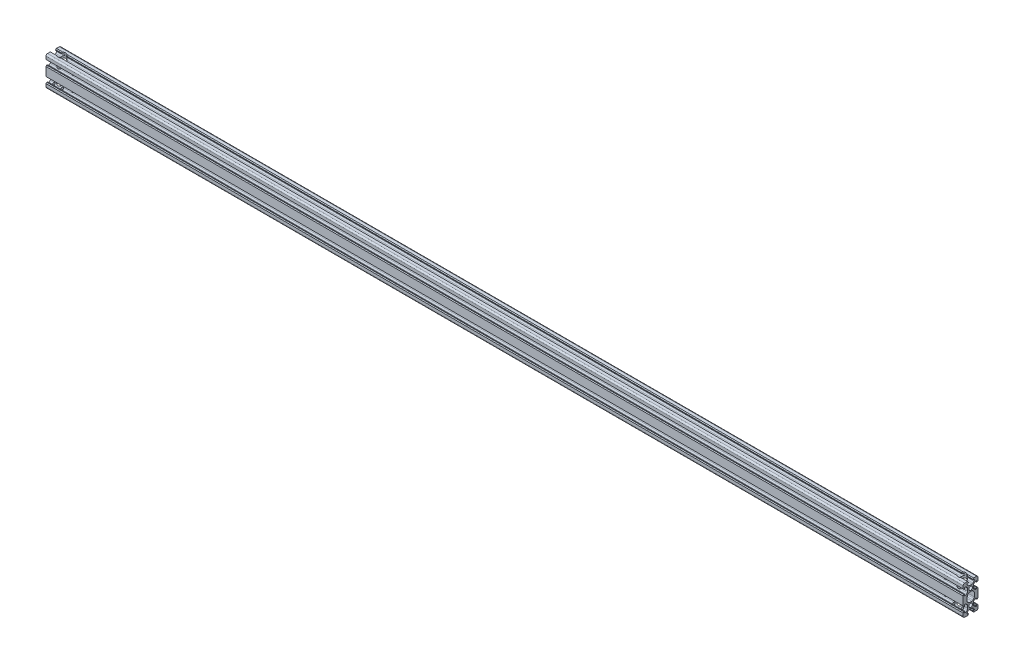
from build123d import *

# Parameters (mm, degrees)
SKETCH1_R           = 2.5
BOSS_EXTRUDE1_DEPTH = 1240
SKETCH2_R           = 5
CUT_EXTRUDE1_DEPTH  = 1241.80618954
SKETCH3_R           = 2.5
CUT_EXTRUDE2_DEPTH  = 1241.80618964
CUT_EXTRUDE3_REACH  = 1242.806
SKETCH4_R           = 5
SKETCH5_R           = 1.4
CUT_EXTRUDE4_DEPTH  = 10


with BuildPart() as part:
    # Sketch1 → Boss-Extrude1 (new body)
    with BuildSketch(Plane(origin=(0, 0, 0), x_dir=(0, 0, -1), z_dir=(1, 0, 0))):
        with BuildLine():
            Line((6.9, 38), (5, 38))
            Line((5, 38), (5, 37.242640687))
            ThreePointArc((5, 37.242640687), (5.152240935, 36.477273822), (5.585786438, 35.828427125))
            Line((5.585786438, 35.828427125), (6.876358939, 34.537854624))
            ThreePointArc((6.876358939, 34.537854624), (7.525205636, 34.104309121), (8.290572501, 33.952068186))
            Line((8.290572501, 33.952068186), (11.709427499, 33.952068186))
            ThreePointArc((11.709427499, 33.952068186), (12.474794364, 34.104309121), (13.123641061, 34.537854624))
            Line((13.123641061, 34.537854624), (14.414213562, 35.828427125))
            ThreePointArc((14.414213562, 35.828427125), (14.847759065, 36.477273822), (15, 37.242640687))
            Line((15, 37.242640687), (15, 38))
            Line((15, 38), (13.1, 38))
            Line((13.1, 38), (13.1, 39))
            Line((13.1, 39), (14.1, 40))
            Line((14.1, 40), (18, 40))
            ThreePointArc((18, 40), (19.414213562, 39.414213562), (20, 38))
            Line((20, 38), (20, 34.1))
            Line((20, 34.1), (19, 33.1))
            Line((19, 33.1), (18, 33.1))
            Line((18, 33.1), (18, 35))
            Line((18, 35), (17.242640687, 35))
            ThreePointArc((17.242640687, 35), (16.477273822, 34.847759065), (15.828427125, 34.414213562))
            Line((15.828427125, 34.414213562), (14.537854624, 33.123641061))
            ThreePointArc((14.537854624, 33.123641061), (14.104309121, 32.474794364), (13.952068186, 31.709427499))
            Line((13.952068186, 31.709427499), (13.952068186, 28.290572501))
            ThreePointArc((13.952068186, 28.290572501), (14.104309121, 27.525205636), (14.537854624, 26.876358939))
            Line((14.537854624, 26.876358939), (15.828427125, 25.585786438))
            ThreePointArc((15.828427125, 25.585786438), (16.477273822, 25.152240935), (17.242640687, 25))
            Line((17.242640687, 25), (18, 25))
            Line((18, 25), (18, 26.9))
            Line((18, 26.9), (19, 26.9))
            Line((19, 26.9), (20, 25.9))
            Line((20, 25.9), (20, 14.1))
            Line((20, 14.1), (19, 13.1))
            Line((19, 13.1), (18, 13.1))
            Line((18, 13.1), (18, 15))
            Line((18, 15), (17.242640687, 15))
            ThreePointArc((17.242640687, 15), (16.477273822, 14.847759065), (15.828427125, 14.414213562))
            Line((15.828427125, 14.414213562), (14.537854624, 13.123641061))
            ThreePointArc((14.537854624, 13.123641061), (14.104309121, 12.474794364), (13.952068186, 11.709427499))
            Line((13.952068186, 11.709427499), (13.952068186, 8.290572501))
            ThreePointArc((13.952068186, 8.290572501), (14.104309121, 7.525205636), (14.537854624, 6.876358939))
            Line((14.537854624, 6.876358939), (15.828427125, 5.585786438))
            ThreePointArc((15.828427125, 5.585786438), (16.477273822, 5.152240935), (17.242640687, 5))
            Line((17.242640687, 5), (18, 5))
            Line((18, 5), (18, 6.9))
            Line((18, 6.9), (19, 6.9))
            Line((19, 6.9), (20, 5.9))
            Line((20, 5.9), (20, 2))
            ThreePointArc((20, 2), (19.414213562, 0.585786438), (18, 0))
            Line((18, 0), (14.1, 0))
            Line((14.1, 0), (13.1, 1))
            Line((13.1, 1), (13.1, 2))
            Line((13.1, 2), (15, 2))
            Line((15, 2), (15, 2.757359313))
            ThreePointArc((15, 2.757359313), (14.847759065, 3.522726178), (14.414213562, 4.171572875))
            Line((14.414213562, 4.171572875), (13.123641061, 5.462145376))
            ThreePointArc((13.123641061, 5.462145376), (12.474794364, 5.895690879), (11.709427499, 6.047931814))
            Line((11.709427499, 6.047931814), (8.290572501, 6.047931814))
            ThreePointArc((8.290572501, 6.047931814), (7.525205636, 5.895690879), (6.876358939, 5.462145376))
            Line((6.876358939, 5.462145376), (5.585786438, 4.171572875))
            ThreePointArc((5.585786438, 4.171572875), (5.152240935, 3.522726178), (5, 2.757359313))
            Line((5, 2.757359313), (5, 2))
            Line((5, 2), (6.9, 2))
            Line((6.9, 2), (6.9, 1))
            Line((6.9, 1), (5.9, 0))
            Line((5.9, 0), (2, 0))
            ThreePointArc((2, 0), (0.585786438, 0.585786438), (0, 2))
            Line((0, 2), (0, 5.9))
            Line((0, 5.9), (1, 6.9))
            Line((1, 6.9), (2, 6.9))
            Line((2, 6.9), (2, 5))
            Line((2, 5), (2.757359313, 5))
            ThreePointArc((2.757359313, 5), (3.522726178, 5.152240935), (4.171572875, 5.585786438))
            Line((4.171572875, 5.585786438), (5.462145376, 6.876358939))
            ThreePointArc((5.462145376, 6.876358939), (5.895690879, 7.525205636), (6.047931814, 8.290572501))
            Line((6.047931814, 8.290572501), (6.047931814, 11.709427499))
            ThreePointArc((6.047931814, 11.709427499), (5.895690879, 12.474794364), (5.462145376, 13.123641061))
            Line((5.462145376, 13.123641061), (4.171572875, 14.414213562))
            ThreePointArc((4.171572875, 14.414213562), (3.522726178, 14.847759065), (2.757359313, 15))
            Line((2.757359313, 15), (2, 15))
            Line((2, 15), (2, 13.1))
            Line((2, 13.1), (1, 13.1))
            Line((1, 13.1), (0, 14.1))
            Line((0, 14.1), (0, 25.9))
            Line((0, 25.9), (1, 26.9))
            Line((1, 26.9), (2, 26.9))
            Line((2, 26.9), (2, 25))
            Line((2, 25), (2.757359313, 25))
            ThreePointArc((2.757359313, 25), (3.522726178, 25.152240935), (4.171572875, 25.585786438))
            Line((4.171572875, 25.585786438), (5.462145376, 26.876358939))
            ThreePointArc((5.462145376, 26.876358939), (5.895690879, 27.525205636), (6.047931814, 28.290572501))
            Line((6.047931814, 28.290572501), (6.047931814, 31.709427499))
            ThreePointArc((6.047931814, 31.709427499), (5.895690879, 32.474794364), (5.462145376, 33.123641061))
            Line((5.462145376, 33.123641061), (4.171572875, 34.414213562))
            ThreePointArc((4.171572875, 34.414213562), (3.522726178, 34.847759065), (2.757359313, 35))
            Line((2.757359313, 35), (2, 35))
            Line((2, 35), (2, 33.1))
            Line((2, 33.1), (1, 33.1))
            Line((1, 33.1), (0, 34.1))
            Line((0, 34.1), (0, 38))
            ThreePointArc((0, 38), (0.585786438, 39.414213562), (2, 40))
            Line((2, 40), (5.9, 40))
            Line((5.9, 40), (6.9, 39))
            Line((6.9, 39), (6.9, 38))
        make_face()
        with Locations((10, 10)):
            Circle(SKETCH1_R, mode=Mode.SUBTRACT)
        with Locations((10, 30)):
            Circle(SKETCH1_R, mode=Mode.SUBTRACT)
        with BuildLine():
            Line((14.414213562, 15.828427125), (13.123641061, 14.537854624))
            ThreePointArc((13.123641061, 14.537854624), (12.474794364, 14.104309121), (11.709427499, 13.952068186))
            Line((11.709427499, 13.952068186), (8.290572501, 13.952068186))
            ThreePointArc((8.290572501, 13.952068186), (7.525205636, 14.104309121), (6.876358939, 14.537854624))
            Line((6.876358939, 14.537854624), (5.585786438, 15.828427125))
            ThreePointArc((5.585786438, 15.828427125), (5.152240935, 16.477273822), (5, 17.242640687))
            Line((5, 17.242640687), (5, 22.757359313))
            ThreePointArc((5, 22.757359313), (5.152240935, 23.522726178), (5.585786438, 24.171572875))
            Line((5.585786438, 24.171572875), (6.876358939, 25.462145376))
            ThreePointArc((6.876358939, 25.462145376), (7.525205636, 25.895690879), (8.290572501, 26.047931814))
            Line((8.290572501, 26.047931814), (11.709427499, 26.047931814))
            ThreePointArc((11.709427499, 26.047931814), (12.474794364, 25.895690879), (13.123641061, 25.462145376))
            Line((13.123641061, 25.462145376), (14.414213562, 24.171572875))
            ThreePointArc((14.414213562, 24.171572875), (14.847759065, 23.522726178), (15, 22.757359313))
            Line((15, 22.757359313), (15, 17.242640687))
            ThreePointArc((15, 17.242640687), (14.847759065, 16.477273822), (14.414213562, 15.828427125))
        make_face(mode=Mode.SUBTRACT)
    extrude(amount=BOSS_EXTRUDE1_DEPTH)

    # Sketch2 → Cut-Extrude1 (cut, through all)
    with BuildSketch(Plane(origin=(0, 40, 0), x_dir=(1, 0, 0), z_dir=(0, 1, 0))):
        with Locations(Location((1228.5, 10, 0), (0, 0, 270))):
            Circle(SKETCH2_R)
        with Locations(Location((11.5, 10, 0), (0, 0, 270))):
            Circle(SKETCH2_R)
    extrude(amount=-CUT_EXTRUDE1_DEPTH, mode=Mode.SUBTRACT)

    # Sketch3 → Cut-Extrude2 (cut, through all)
    with BuildSketch(Plane(origin=(0, 0, -20), x_dir=(-1, 0, 0), z_dir=(0, 0, -1))):
        with Locations(Location((-1210, 30, 0), (0, 0, 316.860970278))):
            Circle(SKETCH3_R)
        with Locations(Location((-1210, 10, 0), (0, 0, 316.860970278))):
            Circle(SKETCH3_R)
        with Locations(Location((-30, 30, 0), (0, 0, 316.860970278))):
            Circle(SKETCH3_R)
        with Locations(Location((-30, 10, 0), (0, 0, 316.860970278))):
            Circle(SKETCH3_R)
    extrude(amount=-CUT_EXTRUDE2_DEPTH, mode=Mode.SUBTRACT)

    # Cut-Extrude3: up to this face of the body (flat: up to its plane)
    cut_extrude3_end = Plane(part.part.faces().sort_by_distance((1218.861363054, 30, -13.952068186))[0])
    # Sketch4 → Cut-Extrude3 (cut, up to the picked face)
    with BuildSketch(Plane(origin=(0, 0, -20), x_dir=(-1, 0, 0), z_dir=(0, 0, -1)), mode=Mode.PRIVATE) as cut_extrude3_sk1:
        with Locations((-1210, 30)):
            Circle(SKETCH4_R)
    cut_extrude3_tool1 = split(extrude(cut_extrude3_sk1.sketch, amount=-CUT_EXTRUDE3_REACH, mode=Mode.PRIVATE), bisect_by=cut_extrude3_end, keep=Keep.BOTH, mode=Mode.PRIVATE)
    # Sketch4 → Cut-Extrude3 (cut, up to the picked face)
    with BuildSketch(Plane(origin=(0, 0, -20), x_dir=(-1, 0, 0), z_dir=(0, 0, -1)), mode=Mode.PRIVATE) as cut_extrude3_sk2:
        with Locations((-1210, 10)):
            Circle(SKETCH4_R)
    cut_extrude3_tool2 = split(extrude(cut_extrude3_sk2.sketch, amount=-CUT_EXTRUDE3_REACH, mode=Mode.PRIVATE), bisect_by=cut_extrude3_end, keep=Keep.BOTH, mode=Mode.PRIVATE)
    # Sketch4 → Cut-Extrude3 (cut, up to the picked face)
    with BuildSketch(Plane(origin=(0, 0, -20), x_dir=(-1, 0, 0), z_dir=(0, 0, -1)), mode=Mode.PRIVATE) as cut_extrude3_sk3:
        with Locations((-30, 10)):
            Circle(SKETCH4_R)
    cut_extrude3_tool3 = split(extrude(cut_extrude3_sk3.sketch, amount=-CUT_EXTRUDE3_REACH, mode=Mode.PRIVATE), bisect_by=cut_extrude3_end, keep=Keep.BOTH, mode=Mode.PRIVATE)
    # Sketch4 → Cut-Extrude3 (cut, up to the picked face)
    with BuildSketch(Plane(origin=(0, 0, -20), x_dir=(-1, 0, 0), z_dir=(0, 0, -1)), mode=Mode.PRIVATE) as cut_extrude3_sk4:
        with Locations((-30, 30)):
            Circle(SKETCH4_R)
    cut_extrude3_tool4 = split(extrude(cut_extrude3_sk4.sketch, amount=-CUT_EXTRUDE3_REACH, mode=Mode.PRIVATE), bisect_by=cut_extrude3_end, keep=Keep.BOTH, mode=Mode.PRIVATE)
    add(cut_extrude3_tool1.solids().sort_by(Axis((1210, 30, -20), (0, 0, 1)))[0], mode=Mode.SUBTRACT)
    add(cut_extrude3_tool2.solids().sort_by(Axis((1210, 10, -20), (0, 0, 1)))[0], mode=Mode.SUBTRACT)
    add(cut_extrude3_tool3.solids().sort_by(Axis((30, 10, -20), (0, 0, 1)))[0], mode=Mode.SUBTRACT)
    add(cut_extrude3_tool4.solids().sort_by(Axis((30, 30, -20), (0, 0, 1)))[0], mode=Mode.SUBTRACT)

    # Sketch5 → Cut-Extrude4 (cut)
    with BuildSketch(Plane.XZ):
        with Locations(Location((26, -10, 0), (0, 0, 270))):
            Circle(SKETCH5_R)
        with Locations(Location((36, -10, 0), (0, 0, 270))):
            Circle(SKETCH5_R)
        with Locations(Location((5.843145751, -4.343145751, 0), (0, 0, 270))):
            Circle(SKETCH5_R)
        with Locations(Location((17.156854249, -4.343145751, 0), (0, 0, 270))):
            Circle(SKETCH5_R)
        with Locations(Location((17.156854249, -15.656854249, 0), (0, 0, 270))):
            Circle(SKETCH5_R)
        with Locations(Location((5.843145751, -15.656854249, 0), (0, 0, 270))):
            Circle(SKETCH5_R)
        with Locations(Location((1234.156854249, -15.656854249, 0), (0, 0, 187.039411846))):
            Circle(SKETCH5_R)
        with Locations(Location((1222.843145751, -15.656854249, 0), (0, 0, 187.039411847))):
            Circle(SKETCH5_R)
        with Locations(Location((1222.843145751, -4.343145751, 0), (0, 0, 306.938070825))):
            Circle(SKETCH5_R)
        with Locations(Location((1234.156854249, -4.343145751, 0), (0, 0, 306.938070825))):
            Circle(SKETCH5_R)
        with Locations(Location((1204, -10, 0), (0, 0, 270))):
            Circle(SKETCH5_R)
        with Locations(Location((1214, -10, 0), (0, 0, 270))):
            Circle(SKETCH5_R)
    extrude(amount=-CUT_EXTRUDE4_DEPTH, mode=Mode.SUBTRACT)


solid = part.part
